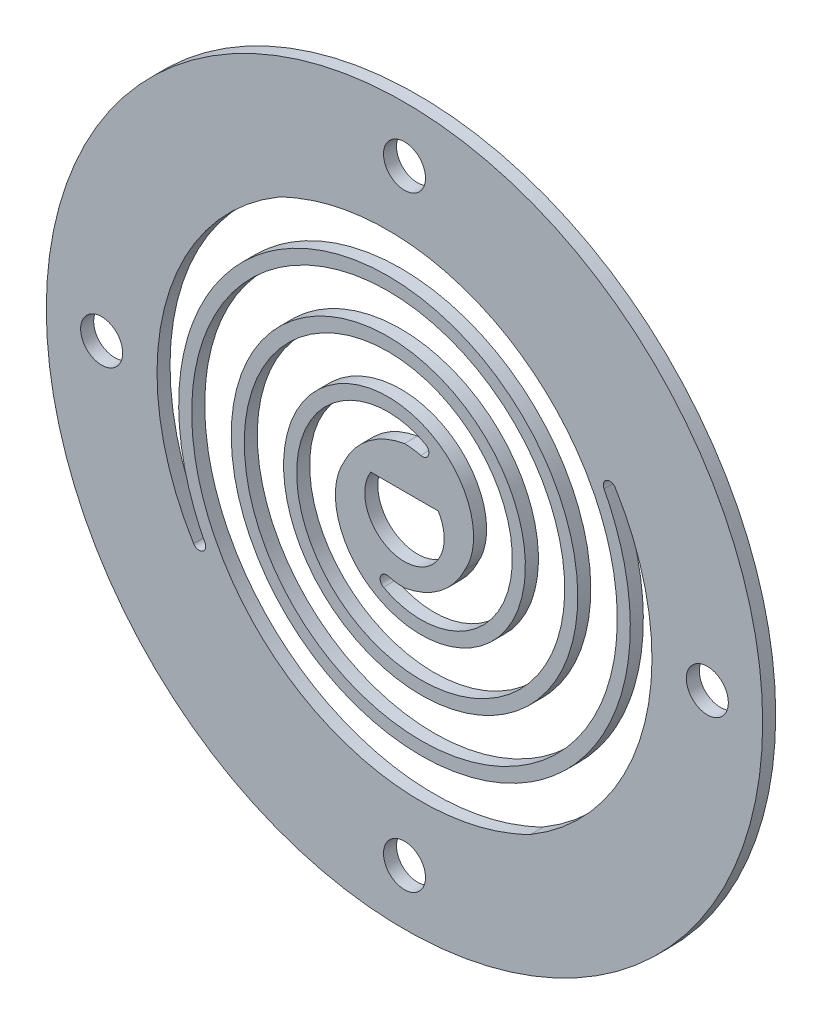
from build123d import *

# Parameters (mm, degrees)
SKETCH1_R             = 27.5
SKETCH1_R_2           = 19
BOSS_EXTRUDE1_DEPTH   = 1
SKETCH1_R_3           = 4.8
BOSS_EXTRUDE1_2_DEPTH = 1
EXTRUDE_THIN1_DEPTH   = 1
CIRPATTERN1_COUNT     = 2
CUT_EXTRUDE2_REACH    = 40.904
SKETCH4_R             = 1.6125
CIRPATTERN2_COUNT     = 4
CUT_EXTRUDE3_REACH    = 40.904
CUT_EXTRUDE4_REACH    = 40.904
FILLET1_R             = 0.5


# Read off the part's stored shape, not the designer's step: Extrude-Thin1
with BuildPart() as part:
    # Sketch1 → Boss-Extrude1 (new body)
    with BuildSketch(Plane.XY):
        Circle(SKETCH1_R)
        Circle(SKETCH1_R_2, mode=Mode.SUBTRACT)
    extrude(amount=BOSS_EXTRUDE1_DEPTH)



with BuildPart() as body_2:
    # Sketch1 → Boss-Extrude1 2 (new body)
    with BuildSketch(Plane.XY):
        Circle(SKETCH1_R_3)
    extrude(amount=BOSS_EXTRUDE1_2_DEPTH)


with BuildPart() as part_1:
    add(part.part)

    add(body_2.part)  # Extrude-Thin1 merges body 2
    # Extrude-Thin1 outline → Extrude-Thin1 (add)
    with BuildSketch(Plane.XY):
        with BuildLine():
            ThreePointArc((-4.1501233, -2.411737256), (-4.762733752, -0.596964995), (-4.616967757, 1.3128628))
            add(Edge.make_bspline(
                [(-4.616967757, 1.3128628), (-4.943081028, 0.765349858), (-5.169864523, 0.127687507), (-5.355306094, -1.278088652), (-5.301842016, -2.043139795), (-4.859188725, -3.551031956), (-4.471479317, -4.286931017), (-3.378938771, -5.588610336), (-2.678159506, -6.148733615), (-1.042414288, -6.965005297), (-0.113326225, -7.217626119), (1.841047876, -7.326442843), (2.859615289, -7.181732933), (4.820481685, -6.466672339), (5.756300869, -5.898120183), (7.373552044, -4.381191967), (8.049759866, -3.436989565), (8.996325909, -1.288459909), (9.263522232, -0.08999614), (9.297351722, 2.388292247), (9.063365167, 3.661498518), (8.079094366, 6.078196523), (7.330817218, 7.21535725), (5.391007136, 9.151271502), (4.203787489, 9.944972922), (1.542657603, 11.024627961), (0.074691301, 11.307599162), (-2.92824168, 11.268635466), (-4.456560603, 10.946257826), (-7.33034721, 9.694244108), (-8.669499753, 8.766782392), (-10.925527578, 6.404837082), (-11.837407727, 4.974817402), (-13.051536764, 1.80120975), (-13.350897147, 0.06369187), (-13.24028216, -3.464237885), (-12.829989003, -5.247909034), (-11.311032582, -8.57944028), (-10.204690735, -10.120933956), (-7.421039782, -12.697868649), (-5.748351277, -13.728311493), (-2.062351415, -15.077701288), (-0.05526103, -15.393807631), (3.997858373, -15.212212358), (6.037623922, -14.714003834), (8.878960382, -13.375371813), (9.78904575, -12.831853057), (11.49761735, -11.565125362), (12.295525838, -10.842324033), (13.744239237, -9.240276265), (14.394557589, -8.361543058), (15.517467071, -6.477900151), (15.989681778, -5.473589371), (16.732030028, -3.375051498), (17.001911961, -2.281485753), (17.322679917, -0.045383588), (17.373448977, 1.09645474), (17.24741181, 3.385004369), (17.070627882, 4.531007949), (16.489819683, 6.782341623), (16.085956187, 7.886981861), (15.060468044, 10.010401061), (14.439136488, 11.028534842), (12.997198381, 12.935951912), (12.177005947, 13.824659784), (10.364331279, 15.434232102), (9.372368201, 16.154613288), (7.25076965, 17.394216417), (6.121738304, 17.913066091), (4.822602666, 18.360179685), (4.700299373, 18.400877508), (4.577510929, 18.440346897)],
                knots=[0.00115634, 0.00115634, 0.00115634, 0.00115634, 0.03125, 0.03125, 0.0625, 0.0625, 0.09375, 0.09375, 0.125, 0.125, 0.15625, 0.15625, 0.1875, 0.1875, 0.21875, 0.21875, 0.25, 0.25, 0.28125, 0.28125, 0.3125, 0.3125, 0.34375, 0.34375, 0.375, 0.375, 0.40625, 0.40625, 0.4375, 0.4375, 0.46875, 0.46875, 0.5, 0.5, 0.53125, 0.53125, 0.5625, 0.5625, 0.59375, 0.59375, 0.625, 0.625, 0.65625, 0.65625, 0.6875, 0.6875, 0.703125, 0.703125, 0.71875, 0.71875, 0.734375, 0.734375, 0.75, 0.75, 0.765625, 0.765625, 0.78125, 0.78125, 0.796875, 0.796875, 0.8125, 0.8125, 0.828125, 0.828125, 0.84375, 0.84375, 0.859375, 0.859375, 0.875, 0.875, 0.876616371, 0.876616371, 0.876616371, 0.876616371], degree=3))
            ThreePointArc((4.577510929, 18.440346897), (-2.753351692, 18.79944293), (-9.673343334, 16.35317794))
            add(Edge.make_bspline(
                [(-4.1501233, -2.411737256), (-4.140847737, -2.446316182), (-4.131142689, -2.480878679), (-3.939210141, -3.134694184), (-3.616075824, -3.750607935), (-2.702428349, -4.839149707), (-2.108008333, -5.315654549), (-0.719539714, -6.008529944), (0.079470824, -6.226811929), (1.759435727, -6.320349946), (2.645540607, -6.195382798), (4.349362419, -5.574057531), (5.171588038, -5.075510068), (6.5900201, -3.745067617), (7.189416593, -2.909474957), (8.026420231, -1.009631675), (8.265465151, 0.059163511), (8.295595109, 2.266430742), (8.08622533, 3.409539414), (7.20396651, 5.575765545), (6.528888144, 6.602881612), (4.780144912, 8.348112743), (3.702973715, 9.068991831), (1.291571564, 10.047329077), (-0.046881443, 10.305937555), (-2.780720694, 10.270465408), (-4.180359364, 9.975807436), (-6.807732822, 8.831147773), (-8.039089064, 7.97899808), (-10.109668769, 5.811207431), (-10.951345321, 4.492240484), (-12.069631173, 1.569157), (-12.347188905, -0.038904784), (-12.244972756, -3.298963874), (-11.864551024, -4.954892969), (-10.456690303, -8.042757716), (-9.427164848, -9.478004816), (-6.839897195, -11.873139799), (-5.279003292, -12.835229849), (-1.844152919, -14.092677547), (0.033496715, -14.388827756), (3.819582772, -14.2191966), (5.731060118, -13.753010958), (8.392947599, -12.498922303), (9.246583219, -11.989175992), (10.8489454, -10.801191507), (11.598145844, -10.122581348), (12.958198357, -8.61857849), (13.569441073, -7.792729059), (14.62467701, -6.022606249), (15.068962883, -5.077809547), (15.76724468, -3.103842752), (16.021424378, -2.074103382), (16.323433053, 0.031226151), (16.371330315, 1.107409235), (16.25255662, 3.264070643), (16.085836354, 4.345142417), (15.53801887, 6.468597204), (15.156757206, 7.511551176), (14.188693018, 9.516065902), (13.601617815, 10.478153088), (12.239295673, 12.280252981), (11.463678882, 13.120727391), (9.749711602, 14.642652057), (8.810908855, 15.324481682), (6.803270202, 16.497500562), (5.733917521, 16.988972516), (3.504017736, 17.756420101), (2.342909638, 18.032571234), (-0.026928113, 18.352470253), (-1.236241063, 18.39628011), (-3.655814801, 18.243434736), (-4.866658511, 18.046726032), (-7.241320503, 17.414186225), (-8.405698768, 16.97818876), (-9.573128135, 16.403356756), (-9.623284003, 16.378382562), (-9.673343334, 16.35317794)],
                knots=[0.060757279, 0.060757279, 0.060757279, 0.060757279, 0.0625, 0.0625, 0.09375, 0.09375, 0.125, 0.125, 0.15625, 0.15625, 0.1875, 0.1875, 0.21875, 0.21875, 0.25, 0.25, 0.28125, 0.28125, 0.3125, 0.3125, 0.34375, 0.34375, 0.375, 0.375, 0.40625, 0.40625, 0.4375, 0.4375, 0.46875, 0.46875, 0.5, 0.5, 0.53125, 0.53125, 0.5625, 0.5625, 0.59375, 0.59375, 0.625, 0.625, 0.65625, 0.65625, 0.6875, 0.6875, 0.703125, 0.703125, 0.71875, 0.71875, 0.734375, 0.734375, 0.75, 0.75, 0.765625, 0.765625, 0.78125, 0.78125, 0.796875, 0.796875, 0.8125, 0.8125, 0.828125, 0.828125, 0.84375, 0.84375, 0.859375, 0.859375, 0.875, 0.875, 0.890625, 0.890625, 0.90625, 0.90625, 0.921875, 0.921875, 0.9375, 0.9375, 0.938202807, 0.938202807, 0.938202807, 0.938202807], degree=3))
        make_face()
    extrude_thin1 = extrude(amount=EXTRUDE_THIN1_DEPTH)

    # CirPattern1: Extrude-Thin1 ×2 about axis
    cirpattern1_axis = Axis((0, 0, 1), (0, 0, -1))
    for i in range(1, CIRPATTERN1_COUNT):
        add(extrude_thin1.rotate(cirpattern1_axis, i * 360 / CIRPATTERN1_COUNT))

    # Sketch4 → Cut-Extrude2 (cut, up to next)
    with BuildSketch(Plane.XY, mode=Mode.PRIVATE) as cut_extrude2_sk1:
        with Locations((-23.25, 0)):
            Circle(SKETCH4_R)
    cut_extrude2_tool1 = extrude(cut_extrude2_sk1.sketch, amount=CUT_EXTRUDE2_REACH, mode=Mode.PRIVATE) & part_1.part
    cut_extrude2 = cut_extrude2_tool1.solids().sort_by_distance((-23.25, 0, 0))[0]
    add(cut_extrude2, mode=Mode.SUBTRACT)

    # CirPattern2: Cut-Extrude2 ×4 about axis
    cirpattern2_axis = Axis((0, 0, 0), (0, 0, 1))
    for i in range(1, CIRPATTERN2_COUNT):
        add(cut_extrude2.rotate(cirpattern2_axis, i * 360 / CIRPATTERN2_COUNT), mode=Mode.SUBTRACT)

    # Sketch6 → Cut-Extrude3 (cut, up to next)
    with BuildSketch(Plane.XY, mode=Mode.PRIVATE) as cut_extrude3_sk1:
        with BuildLine():
            Line((-2.590443977, 1.61), (2.590443977, 1.61))
            ThreePointArc((2.590443977, 1.61), (0, -3.05), (-2.590443977, 1.61))
        make_face()
    cut_extrude3_tool1 = extrude(cut_extrude3_sk1.sketch, amount=CUT_EXTRUDE3_REACH, mode=Mode.PRIVATE) & part_1.part
    add(cut_extrude3_tool1.solids().sort_by_distance((0, -0.483746, 0))[0], mode=Mode.SUBTRACT)

    # Sketch7 → Cut-Extrude4 (cut, up to next)
    with BuildSketch(Plane.XY, mode=Mode.PRIVATE) as cut_extrude4_sk1:
        with BuildLine():
            ThreePointArc((-4.616967757, 1.3128628), (-2.892944742, 3.830257265), (0, 4.8))
            ThreePointArc((0, 4.8), (-2.733088901, 3.618608219), (-4.616967757, 1.3128628))
        make_face()
    cut_extrude4_tool1 = extrude(cut_extrude4_sk1.sketch, amount=CUT_EXTRUDE4_REACH, mode=Mode.PRIVATE) & part_1.part
    # Sketch7 → Cut-Extrude4 (cut, up to next)
    with BuildSketch(Plane.XY, mode=Mode.PRIVATE) as cut_extrude4_sk2:
        with BuildLine():
            ThreePointArc((4.616967757, -1.3128628), (2.892944742, -3.830257265), (0, -4.8))
            ThreePointArc((0, -4.8), (2.733088901, -3.618608219), (4.616967757, -1.3128628))
        make_face()
    cut_extrude4_tool2 = extrude(cut_extrude4_sk2.sketch, amount=CUT_EXTRUDE4_REACH, mode=Mode.PRIVATE) & part_1.part
    add(cut_extrude4_tool1.solids().sort_by_distance((-2.858073, 3.784088, 0))[0], mode=Mode.SUBTRACT)
    add(cut_extrude4_tool2.solids().sort_by_distance((2.858073, -3.784088, 0))[0], mode=Mode.SUBTRACT)

    # Fillet1
    fillet1_edges = [part_1.edges().sort_by_distance(p)[0] for p in [
        (4.577510929, 18.440346897, 0.5),
        (-4.1501233, -2.411737256, 0.5),
        (4.1501233, 2.411737256, 0.5),
        (-4.577510929, -18.440346897, 0.5),
    ]]
    fillet(fillet1_edges, radius=FILLET1_R)


solid = part_1.part
